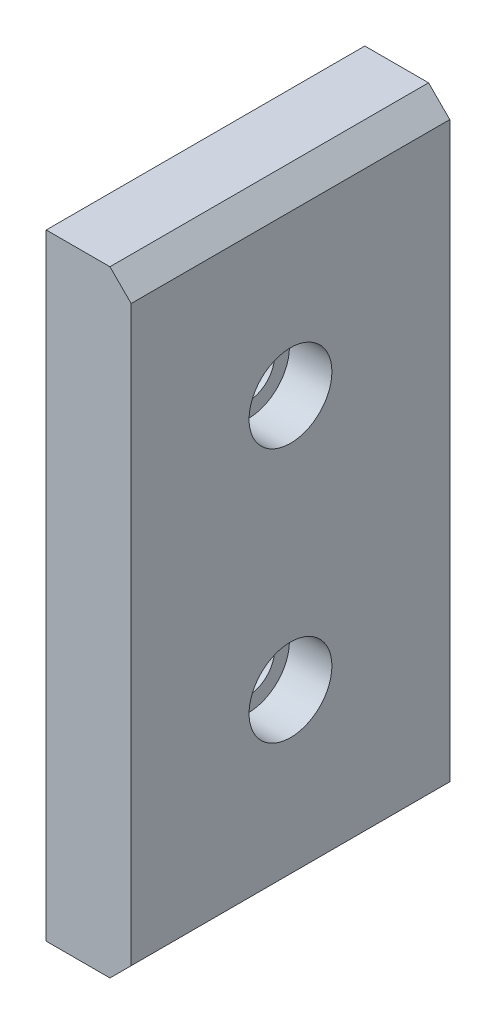
from build123d import *

# Parameters (mm, degrees)
SKETCH_1_W          = 15
SKETCH_1_H          = 29
SKETCH_1_R          = 1.25
EXTRUDE_1_DEPTH     = 4
SKETCH_2_R          = 1.95
CUT_EXTRUDE_1_DEPTH = 2
CHAMFER_1_SIZE      = 1


with BuildPart() as part:
    # Эскиз1 → Бобышка-Вытянуть1 (new body)
    with BuildSketch(Plane(origin=(0, 0, 0), x_dir=(0, 0, -1), z_dir=(1, 0, 0))):
        Rectangle(SKETCH_1_W, SKETCH_1_H)
        with Locations((0, 6)):
            Circle(SKETCH_1_R, mode=Mode.SUBTRACT)
        with Locations((0, -6)):
            Circle(SKETCH_1_R, mode=Mode.SUBTRACT)
    extrude(amount=EXTRUDE_1_DEPTH)

    # Эскиз2 → Вырез-Вытянуть1 (cut)
    with BuildSketch(Plane(origin=(4, 0, 0), x_dir=(0, 0, -1), z_dir=(1, 0, 0))):
        with Locations((0, 6)):
            Circle(SKETCH_2_R)
        with Locations((0, -6)):
            Circle(SKETCH_2_R)
    extrude(amount=-CUT_EXTRUDE_1_DEPTH, mode=Mode.SUBTRACT)

    # Фаска1
    chamfer_1_edges = [part.edges().sort_by_distance(p)[0] for p in [
        (4, -14.5, 0),
        (4, 14.5, 0),
    ]]
    chamfer(chamfer_1_edges, length=CHAMFER_1_SIZE)


solid = part.part
